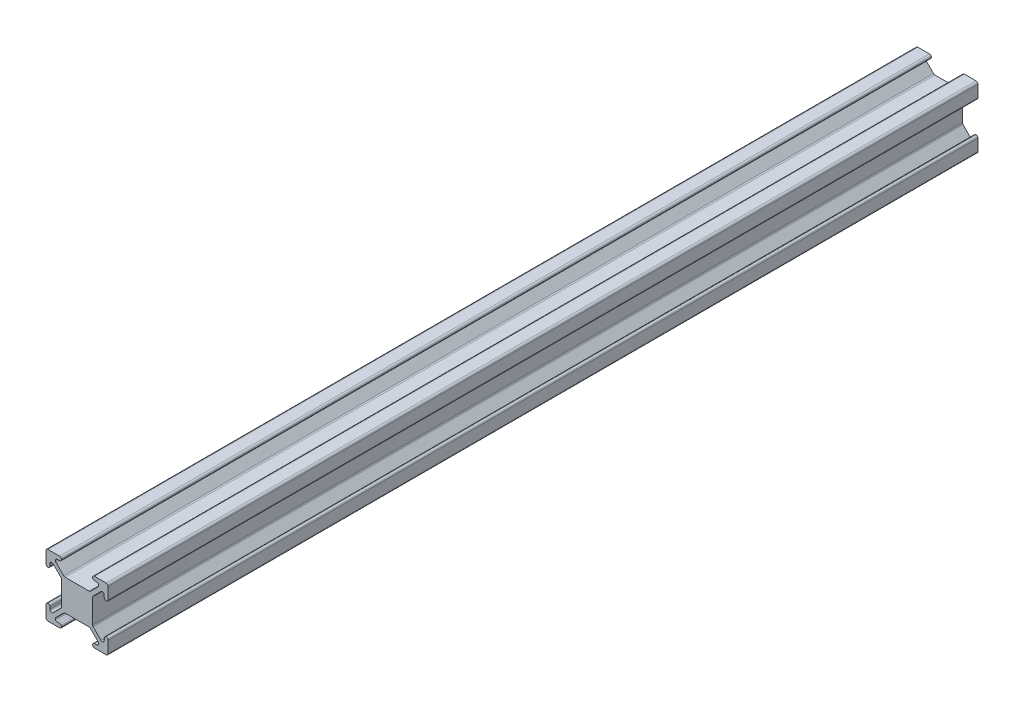
from build123d import *

# Parameters (mm, degrees)
BOSS_EXTRUDE1_DEPTH = 355.6
FILLET1_R           = 0.79375


with BuildPart() as part:
    # Sketch1 → Boss-Extrude1 (new body)
    with BuildSketch(Plane.XY):
        Polygon((-6.35, -5.227467985), (-6.35, 5.227467985), (-11.1125, 9.989967985), (-11.1125, 6.35), (-12.7, 6.35), (-12.7, 12.7), (-6.35, 12.7), (-6.35, 11.1125), (-9.989967985, 11.1125), (-5.227467985, 6.35), (5.227467985, 6.35), (9.989967985, 11.1125), (6.35, 11.1125), (6.35, 12.7), (12.7, 12.7), (12.7, 6.35), (11.1125, 6.35), (11.1125, 9.989967985), (6.35, 5.227467985), (6.35, -5.227467985), (11.1125, -9.989967985), (11.1125, -6.35), (12.7, -6.35), (12.7, -12.7), (6.35, -12.7), (6.35, -11.1125), (9.989967985, -11.1125), (5.227467985, -6.35), (-5.227467985, -6.35), (-9.989967985, -11.1125), (-6.35, -11.1125), (-6.35, -12.7), (-12.7, -12.7), (-12.7, -6.35), (-11.1125, -6.35), (-11.1125, -9.989967985), align=None)
    extrude(amount=-BOSS_EXTRUDE1_DEPTH)

    # Fillet1
    fillet1_edges = [part.edges().sort_by_distance(p)[0] for p in [
        (-6.35, -11.1125, -177.8),
        (-6.35, -12.7, -177.8),
        (-12.7, -12.7, -177.8),
        (-12.7, -6.35, -177.8),
        (-11.1125, -6.35, -177.8),
        (-11.1125, -9.989967985, -177.8),
        (-6.35, -5.227467985, -177.8),
        (-6.35, 5.227467985, -177.8),
        (-11.1125, 9.989967985, -177.8),
        (-11.1125, 6.35, -177.8),
        (-12.7, 6.35, -177.8),
        (-12.7, 12.7, -177.8),
        (-6.35, 12.7, -177.8),
        (-6.35, 11.1125, -177.8),
        (-9.989967985, 11.1125, -177.8),
        (-5.227467985, 6.35, -177.8),
        (5.227467985, 6.35, -177.8),
        (9.989967985, 11.1125, -177.8),
        (6.35, 11.1125, -177.8),
        (6.35, 12.7, -177.8),
        (12.7, 12.7, -177.8),
        (12.7, 6.35, -177.8),
        (11.1125, 6.35, -177.8),
        (11.1125, 9.989967985, -177.8),
        (6.35, 5.227467985, -177.8),
        (6.35, -5.227467985, -177.8),
        (11.1125, -9.989967985, -177.8),
        (11.1125, -6.35, -177.8),
        (12.7, -6.35, -177.8),
        (12.7, -12.7, -177.8),
        (6.35, -12.7, -177.8),
        (6.35, -11.1125, -177.8),
        (9.989967985, -11.1125, -177.8),
        (5.227467985, -6.35, -177.8),
        (-5.227467985, -6.35, -177.8),
        (-9.989967985, -11.1125, -177.8),
    ]]
    fillet(fillet1_edges, radius=FILLET1_R - 0.0001)  # a hair under: the kernel refuses the full size


solid = part.part
